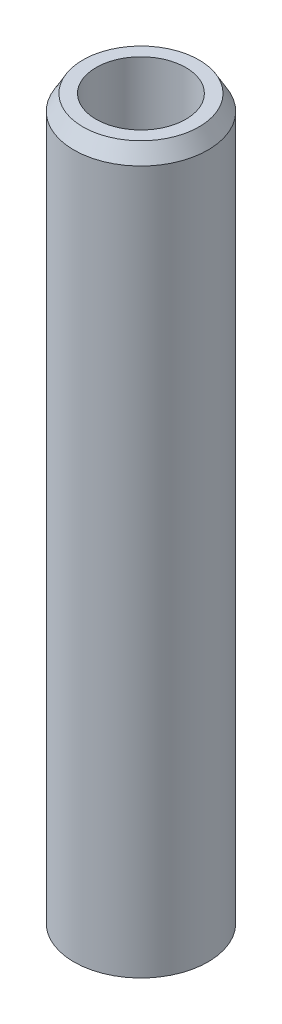
from build123d import *
from OCP.BRepFilletAPI import BRepFilletAPI_MakeChamfer

# Parameters (mm, degrees)
SKETCH1_R           = 10
BOSS_EXTRUDE1_DEPTH = 108.565487077
SKETCH2_R           = 6.695791622
CUT_EXTRUDE1_DEPTH  = 110.482715459
CHAMFER1_SIZE       = 2.319404692
CHAMFER1_SIZE2      = 1.339108923


with BuildPart() as part:
    # Sketch1 → Boss-Extrude1 (new body)
    with BuildSketch(Plane(origin=(0, 0, 0), x_dir=(1, 0, 0), z_dir=(0, 1, 0))):
        Circle(SKETCH1_R)
    extrude(amount=BOSS_EXTRUDE1_DEPTH)

    # Sketch2 → Cut-Extrude1 (cut, through all)
    with BuildSketch(Plane(origin=(0, 0, 0), x_dir=(1, 0, 0), z_dir=(0, 1, 0))):
        Circle(SKETCH2_R)
    extrude(amount=CUT_EXTRUDE1_DEPTH, mode=Mode.SUBTRACT)

    # Chamfer1: one chamfer whose edges measure the first distance from different faces: ONE call of the kernel's chamfer builder (chamfer() names one face for all edges)
    chamfer1_edges_1 = [part.edges().sort_by_distance(p)[0] for p in [
        (-10, 108.565487077, 0),
    ]]
    chamfer1_side_1 = [part.faces().sort_by_distance(p)[0] for p in [
        (-10, 54.282743539, 0),
    ]]
    chamfer1_edges_2 = [part.edges().sort_by_distance(p)[0] for p in [
        (-10, 0, 0),
    ]]
    chamfer1_side_2 = [part.faces().sort_by_distance(p)[0] for p in [
        (-9.717157288, 0, 0),
    ]]
    chamfer1 = BRepFilletAPI_MakeChamfer(part.part.solid().wrapped)
    for e in chamfer1_edges_1:
        chamfer1.Add(CHAMFER1_SIZE, CHAMFER1_SIZE2, e.wrapped, chamfer1_side_1[0].wrapped)  # the first distance lies on this face
    for e in chamfer1_edges_2:
        chamfer1.Add(CHAMFER1_SIZE, CHAMFER1_SIZE2, e.wrapped, chamfer1_side_2[0].wrapped)  # the first distance lies on this face
    add(Compound.cast(chamfer1.Shape()), mode=Mode.REPLACE)


solid = part.part
